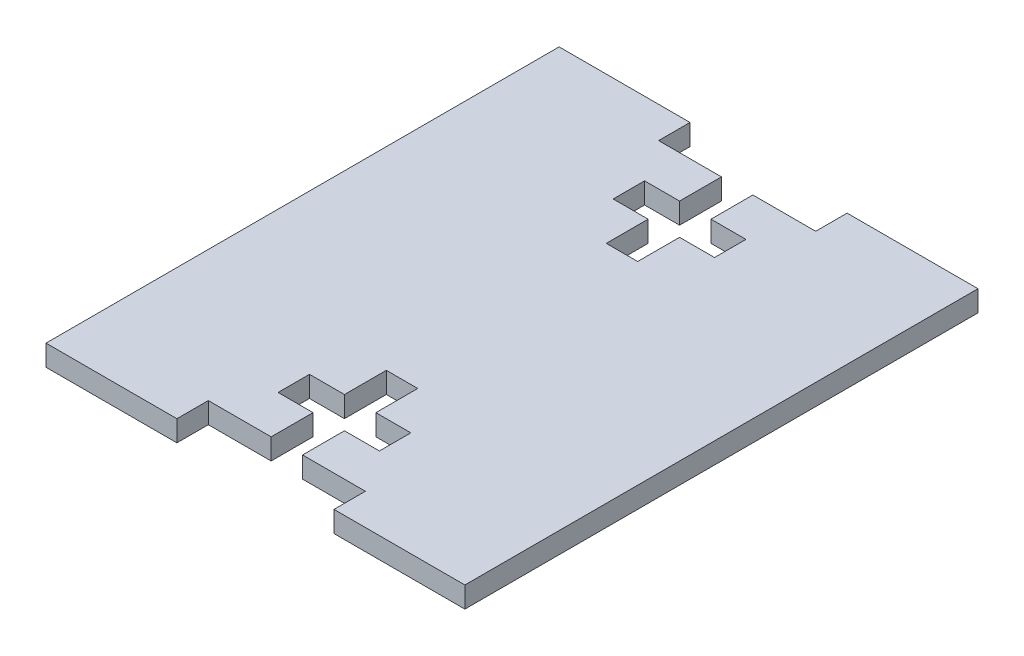
from build123d import *

# Parameters (mm, degrees)
SCHIZZO1_W                   = 40
SCHIZZO1_H                   = 49
ESTRUSIONE_ESTRUSIONE2_DEPTH = 2
SCHIZZO2_W                   = 15
SCHIZZO2_H                   = 3
TAGLIO_ESTRUSIONE1_DEPTH     = 62.491080057
TAGLIO_ESTRUSIONE3_DEPTH     = 62.491080057


with BuildPart() as part:
    # Schizzo1 → Estrusione-Estrusione2 (new body)
    with BuildSketch(Plane(origin=(0, 0, 0), x_dir=(1, 0, 0), z_dir=(0, 1, 0))):
        with Locations((-34.56494914, -3.781075862)):
            Rectangle(SCHIZZO1_W, SCHIZZO1_H)
    extrude(amount=-ESTRUSIONE_ESTRUSIONE2_DEPTH)

    # Schizzo2 → Taglio-Estrusione1 (cut, through all)
    with BuildSketch(Plane(origin=(0, 0, 0), x_dir=(1, 0, 0), z_dir=(0, 1, 0))):
        with Locations((-34.56494914, -26.781075862)):
            Rectangle(SCHIZZO2_W, SCHIZZO2_H)
        with Locations((-34.56494914, 19.218924138)):
            Rectangle(SCHIZZO2_W, SCHIZZO2_H)
    extrude(amount=-TAGLIO_ESTRUSIONE1_DEPTH, mode=Mode.SUBTRACT)

    # Schizzo3 → Taglio-Estrusione3 (cut, through all)
    with BuildSketch(Plane(origin=(0, 0, 0), x_dir=(1, 0, 0), z_dir=(0, 1, 0))):
        Polygon((-36.06494914, -25.281075862), (-33.06494914, -25.281075862), (-33.06494914, -21.281075862), (-29.72494914, -21.281075862), (-29.72494914, -18.281075862), (-33.06494914, -18.281075862), (-33.06494914, -14.281075862), (-36.06494914, -14.281075862), (-36.06494914, -18.281075862), (-39.40494914, -18.281075862), (-39.40494914, -21.281075862), (-36.06494914, -21.281075862), align=None)
        Polygon((-36.06494914, 6.718924138), (-33.06494914, 6.718924138), (-33.06494914, 10.718924138), (-29.72494914, 10.718924138), (-29.72494914, 13.718924138), (-33.06494914, 13.718924138), (-33.06494914, 17.718924138), (-36.06494914, 17.718924138), (-36.06494914, 13.718924138), (-39.40494914, 13.718924138), (-39.40494914, 10.718924138), (-36.06494914, 10.718924138), align=None)
    extrude(amount=-TAGLIO_ESTRUSIONE3_DEPTH, mode=Mode.SUBTRACT)


solid = part.part
